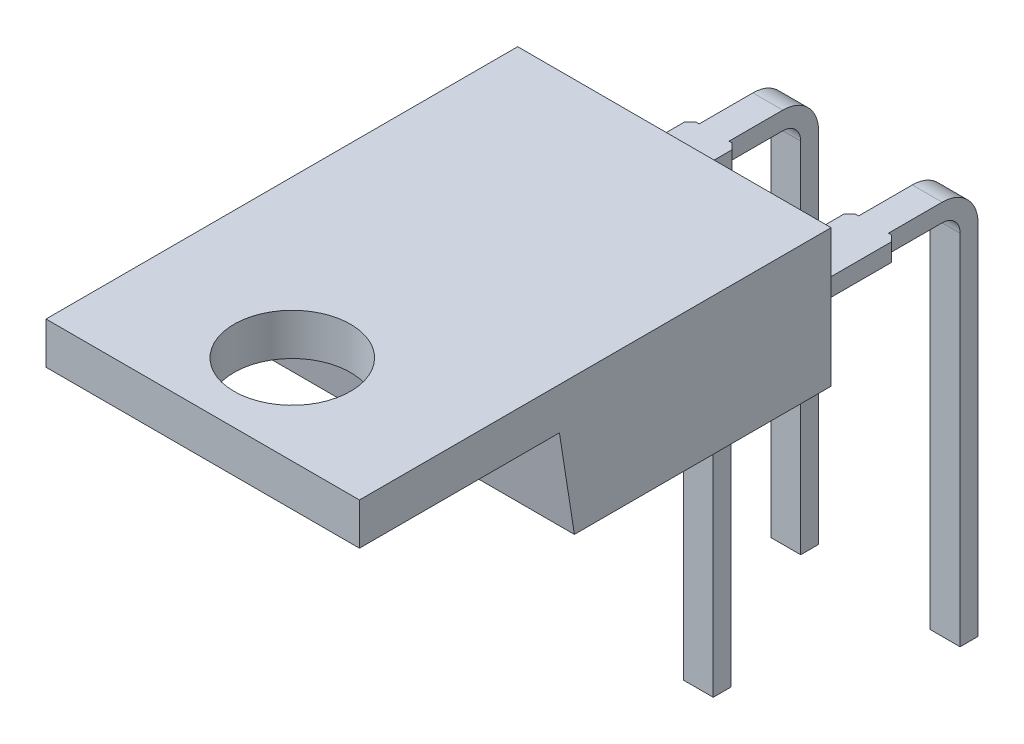
from build123d import *

# Parameters (mm, degrees)
CORTAR_EXTRUIR1_START       = 1.8
CORTAR_EXTRUIR1_OUTLINE_W   = 10.5
CORTAR_EXTRUIR1_OUTLINE_H   = 15.8
CORTAR_EXTRUIR1_OUTLINE_R   = 1.95
CORTAR_EXTRUIR1_DEPTH       = 1.4
CORTAR_EXTRUIR1_START_2     = -0.6
CORTAR_EXTRUIR1_2_DEPTH     = 0.6
CORTAR_EXTRUIR1_START_3     = 1.79
CORTAR_EXTRUIR1_3_OUTLINE_W = 10.5
CORTAR_EXTRUIR1_3_OUTLINE_H = 9.1
CORTAR_EXTRUIR1_3_DEPTH     = 0.01
CORTAR_EXTRUIR1_START_4     = -5.25
CORTAR_EXTRUIR1_4_DEPTH     = 10.5
CROQUIS2_W                  = 1.6
CROQUIS2_H                  = 4.4
CORTAR_EXTRUIR2_DEPTH       = 10
EXTRUIR_L_MINA1_DEPTH       = 0.8
CROQUIS5_W                  = 8.6
CROQUIS5_H                  = 0.6
CORTAR_EXTRUIR3_DEPTH       = 25.279546948
EXTRUIR_L_MINA2_DEPTH       = 0.5
CUT_EXTRUDE1_DEPTH          = 10


with BuildPart() as part:
    # Cortar-Extruir1: read off the stored shape, not the designer's step
    # Cortar-Extruir1 outline → Cortar-Extruir1 (new body)
    with BuildSketch(Plane(origin=(0, -3.2, 0), x_dir=(1, 0, 0), z_dir=(0, 1, 0)).offset(CORTAR_EXTRUIR1_START)):
        with Locations((0, -7.9)):
            Rectangle(CORTAR_EXTRUIR1_OUTLINE_W, CORTAR_EXTRUIR1_OUTLINE_H)
        with Locations((0, -12.8)):
            Circle(CORTAR_EXTRUIR1_OUTLINE_R, mode=Mode.SUBTRACT)
    extrude(amount=CORTAR_EXTRUIR1_DEPTH)

    # Cortar-Extruir1 3 outline → Cortar-Extruir1 3 (add)
    with BuildSketch(Plane(origin=(0, -3.2, 0), x_dir=(1, 0, 0), z_dir=(0, 1, 0)).offset(CORTAR_EXTRUIR1_START_3)):
        with Locations((0, -4.55)):
            Rectangle(CORTAR_EXTRUIR1_3_OUTLINE_W, CORTAR_EXTRUIR1_3_OUTLINE_H)
    extrude(amount=CORTAR_EXTRUIR1_3_DEPTH)



with BuildPart() as body_2:
    # Cortar-Extruir1 2 outline → Cortar-Extruir1 2 (new body)
    with BuildSketch(Plane(origin=(0, -3.2, 0), x_dir=(1, 0, 0), z_dir=(0, 1, 0)).offset(CORTAR_EXTRUIR1_START_2)):
        Polygon((1.87, 0), (3.47, 0), (3.47, 3.8), (3.27, 4), (3.17, 4), (3.17, 14.4), (2.17, 14.4), (2.17, 4), (2.07, 4), (1.87, 3.8), align=None)
        Polygon((-0.8, 0), (0.8, 0), (0.8, 3.8), (0.6, 4), (0.5, 4), (0.5, 4.5), (-0.5, 4.5), (-0.5, 4), (-0.6, 4), (-0.8, 3.8), align=None)
        Polygon((-3.47, 0), (-1.87, 0), (-1.87, 3.8), (-2.07, 4), (-2.17, 4), (-2.17, 14.4), (-3.17, 14.4), (-3.17, 4), (-3.27, 4), (-3.47, 3.8), align=None)
    extrude(amount=CORTAR_EXTRUIR1_2_DEPTH)


with BuildPart() as part_1:
    add(part.part)

    add(body_2.part)  # Cortar-Extruir1 4 merges body 2
    # Cortar-Extruir1 4 outline → Cortar-Extruir1 4 (add)
    with BuildSketch(Plane.YZ.offset(CORTAR_EXTRUIR1_START_4)):
        Polygon((-1.41, 9.1), (-4.6, 8.6), (-4.6, 0), (-1.41, 0), align=None)
    extrude(amount=CORTAR_EXTRUIR1_4_DEPTH)

    # Croquis2 → Cortar-Extruir2 (cut)
    with BuildSketch(Plane(origin=(0, -3.2, 0), x_dir=(1, 0, 0), z_dir=(0, 1, 0))):
        with Locations((0, 2.3)):
            Rectangle(CROQUIS2_W, CROQUIS2_H)
    extrude(amount=-CORTAR_EXTRUIR2_DEPTH, mode=Mode.SUBTRACT)

    # Croquis3 → Extruir-Lámina1 (add, symmetric)
    with BuildSketch(Plane(origin=(0, 0, 0), x_dir=(0, 0, -1), z_dir=(1, 0, 0))):
        with BuildLine():
            Line((0.1, -3.8), (0.2, -3.8))
            ThreePointArc((0.2, -3.8), (0.624264069, -3.975735931), (0.8, -4.4))
            Line((0.8, -4.4), (0.8, -16.4))
            Line((0.8, -16.4), (1.4, -16.4))
            Line((1.4, -16.4), (1.4, -4.4))
            ThreePointArc((1.4, -4.4), (1.048528137, -3.551471863), (0.2, -3.2))
            Line((0.2, -3.2), (0.1, -3.2))
            Line((0.1, -3.2), (0.1, -3.8))
        make_face()
    extrude(amount=EXTRUIR_L_MINA1_DEPTH, both=True)

    # Croquis5 → Cortar-Extruir3 (cut, through all)
    with BuildSketch(Plane(origin=(3.17, 0, 0), x_dir=(0, 0, -1), z_dir=(1, 0, 0))):
        with Locations((10.1, -3.5)):
            Rectangle(CROQUIS5_W, CROQUIS5_H)
    extrude(amount=-CORTAR_EXTRUIR3_DEPTH, mode=Mode.SUBTRACT)

    # Croquis6 → Extruir-Lámina2 (add, symmetric)
    with BuildSketch(Plane(origin=(-2.67, 0, 0), x_dir=(0, 0, -1), z_dir=(1, 0, 0))):
        with BuildLine():
            ThreePointArc((5.8, -3.8), (6.224264069, -3.975735931), (6.4, -4.4))
            Line((6.4, -4.4), (6.4, -16.4))
            Line((6.4, -16.4), (7, -16.4))
            Line((7, -16.4), (7, -4.4))
            ThreePointArc((7, -4.4), (6.648528137, -3.551471863), (5.8, -3.2))
            Line((5.8, -3.2), (5.8, -3.8))
        make_face()
    extruir_l_mina2 = extrude(amount=EXTRUIR_L_MINA2_DEPTH, both=True)

    # Simetría1: Extruir-Lámina2 across plane
    add(extruir_l_mina2.mirror(Plane(origin=(0, 0, 0), x_dir=(0, 0, 1), z_dir=(1, 0, 0))))

    # Sketch2 → Cut-Extrude1 (cut)
    with BuildSketch(Plane(origin=(0, 0, -1.4), x_dir=(-1, 0, 0), z_dir=(0, 0, -1))):
        Polygon((-0.5, -16.4), (-0.5, -7.3), (-0.6, -7.3), (-0.8, -7.1), (-0.8, -16.4), align=None)
        Polygon((0.8, -16.4), (0.5, -16.4), (0.5, -7.3), (0.6, -7.3), (0.8, -7.1), align=None)
    extrude(amount=-CUT_EXTRUDE1_DEPTH, mode=Mode.SUBTRACT)


solid = part_1.part
